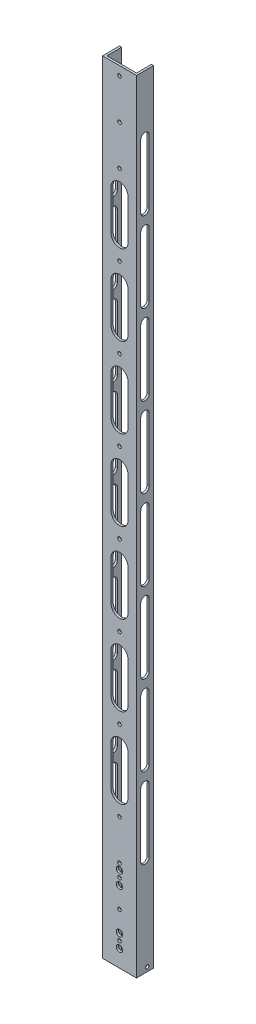
from build123d import *

# Parameters (mm, degrees)
BOSS_EXTRUDE1_DEPTH = 1168.4
IGUS_HOLES_REACH    = 1171.78
SKETCH2_R           = 2.667
CUT_EXTRUDE2_REACH  = 1171.715
SKETCH3_R           = 4.7625
SKETCH3_R_2         = 2.667
SKETCH4_R           = 2.667
CUT_EXTRUDE3_DEPTH  = 1170.77962027
BACK_CUTS_REACH     = 1171.78
CUT_EXTRUDE5_DEPTH  = 1170.77962027


with BuildPart() as part:
    # Sketch1 → Boss-Extrude1 (new body)
    with BuildSketch(Plane(origin=(0, 0, 0), x_dir=(1, 0, 0), z_dir=(0, 1, 0))):
        Polygon((3.175, 3.175), (3.175, 25.4), (0, 25.4), (0, 0), (50.8, 0), (50.8, 25.4), (47.625, 25.4), (47.625, 3.175), align=None)
    extrude(amount=BOSS_EXTRUDE1_DEPTH)

    # Sketch2 → Igus_Holes (cut, up to next)
    with BuildSketch(Plane.XY, mode=Mode.PRIVATE) as igus_holes_sk1:
        with Locations((25.4, 76.2)):
            Circle(SKETCH2_R)
    igus_holes_tool1 = extrude(igus_holes_sk1.sketch, amount=-IGUS_HOLES_REACH, mode=Mode.PRIVATE) & part.part
    # Sketch2 → Igus_Holes (cut, up to next)
    with BuildSketch(Plane.XY, mode=Mode.PRIVATE) as igus_holes_sk2:
        with Locations((25.4, 136.144)):
            Circle(SKETCH2_R)
    igus_holes_tool2 = extrude(igus_holes_sk2.sketch, amount=-IGUS_HOLES_REACH, mode=Mode.PRIVATE) & part.part
    # Sketch2 → Igus_Holes (cut, up to next)
    with BuildSketch(Plane.XY, mode=Mode.PRIVATE) as igus_holes_sk3:
        with Locations((25.4, 196.088)):
            Circle(SKETCH2_R)
    igus_holes_tool3 = extrude(igus_holes_sk3.sketch, amount=-IGUS_HOLES_REACH, mode=Mode.PRIVATE) & part.part
    # Sketch2 → Igus_Holes (cut, up to next)
    with BuildSketch(Plane.XY, mode=Mode.PRIVATE) as igus_holes_sk4:
        with Locations((25.4, 256.032)):
            Circle(SKETCH2_R)
    igus_holes_tool4 = extrude(igus_holes_sk4.sketch, amount=-IGUS_HOLES_REACH, mode=Mode.PRIVATE) & part.part
    # Sketch2 → Igus_Holes (cut, up to next)
    with BuildSketch(Plane.XY, mode=Mode.PRIVATE) as igus_holes_sk5:
        with Locations((25.4, 315.976)):
            Circle(SKETCH2_R)
    igus_holes_tool5 = extrude(igus_holes_sk5.sketch, amount=-IGUS_HOLES_REACH, mode=Mode.PRIVATE) & part.part
    # Sketch2 → Igus_Holes (cut, up to next)
    with BuildSketch(Plane.XY, mode=Mode.PRIVATE) as igus_holes_sk6:
        with Locations((25.4, 375.92)):
            Circle(SKETCH2_R)
    igus_holes_tool6 = extrude(igus_holes_sk6.sketch, amount=-IGUS_HOLES_REACH, mode=Mode.PRIVATE) & part.part
    # Sketch2 → Igus_Holes (cut, up to next)
    with BuildSketch(Plane.XY, mode=Mode.PRIVATE) as igus_holes_sk7:
        with Locations((25.4, 435.864)):
            Circle(SKETCH2_R)
    igus_holes_tool7 = extrude(igus_holes_sk7.sketch, amount=-IGUS_HOLES_REACH, mode=Mode.PRIVATE) & part.part
    # Sketch2 → Igus_Holes (cut, up to next)
    with BuildSketch(Plane.XY, mode=Mode.PRIVATE) as igus_holes_sk8:
        with Locations((25.4, 495.808)):
            Circle(SKETCH2_R)
    igus_holes_tool8 = extrude(igus_holes_sk8.sketch, amount=-IGUS_HOLES_REACH, mode=Mode.PRIVATE) & part.part
    # Sketch2 → Igus_Holes (cut, up to next)
    with BuildSketch(Plane.XY, mode=Mode.PRIVATE) as igus_holes_sk9:
        with Locations((25.4, 555.752)):
            Circle(SKETCH2_R)
    igus_holes_tool9 = extrude(igus_holes_sk9.sketch, amount=-IGUS_HOLES_REACH, mode=Mode.PRIVATE) & part.part
    # Sketch2 → Igus_Holes (cut, up to next)
    with BuildSketch(Plane.XY, mode=Mode.PRIVATE) as igus_holes_sk10:
        with Locations((25.4, 615.696)):
            Circle(SKETCH2_R)
    igus_holes_tool10 = extrude(igus_holes_sk10.sketch, amount=-IGUS_HOLES_REACH, mode=Mode.PRIVATE) & part.part
    # Sketch2 → Igus_Holes (cut, up to next)
    with BuildSketch(Plane.XY, mode=Mode.PRIVATE) as igus_holes_sk11:
        with Locations((25.4, 675.64)):
            Circle(SKETCH2_R)
    igus_holes_tool11 = extrude(igus_holes_sk11.sketch, amount=-IGUS_HOLES_REACH, mode=Mode.PRIVATE) & part.part
    # Sketch2 → Igus_Holes (cut, up to next)
    with BuildSketch(Plane.XY, mode=Mode.PRIVATE) as igus_holes_sk12:
        with Locations((25.4, 735.584)):
            Circle(SKETCH2_R)
    igus_holes_tool12 = extrude(igus_holes_sk12.sketch, amount=-IGUS_HOLES_REACH, mode=Mode.PRIVATE) & part.part
    # Sketch2 → Igus_Holes (cut, up to next)
    with BuildSketch(Plane.XY, mode=Mode.PRIVATE) as igus_holes_sk13:
        with Locations((25.4, 795.528)):
            Circle(SKETCH2_R)
    igus_holes_tool13 = extrude(igus_holes_sk13.sketch, amount=-IGUS_HOLES_REACH, mode=Mode.PRIVATE) & part.part
    # Sketch2 → Igus_Holes (cut, up to next)
    with BuildSketch(Plane.XY, mode=Mode.PRIVATE) as igus_holes_sk14:
        with Locations((25.4, 855.472)):
            Circle(SKETCH2_R)
    igus_holes_tool14 = extrude(igus_holes_sk14.sketch, amount=-IGUS_HOLES_REACH, mode=Mode.PRIVATE) & part.part
    # Sketch2 → Igus_Holes (cut, up to next)
    with BuildSketch(Plane.XY, mode=Mode.PRIVATE) as igus_holes_sk15:
        with Locations((25.4, 915.416)):
            Circle(SKETCH2_R)
    igus_holes_tool15 = extrude(igus_holes_sk15.sketch, amount=-IGUS_HOLES_REACH, mode=Mode.PRIVATE) & part.part
    # Sketch2 → Igus_Holes (cut, up to next)
    with BuildSketch(Plane.XY, mode=Mode.PRIVATE) as igus_holes_sk16:
        with Locations((25.4, 975.36)):
            Circle(SKETCH2_R)
    igus_holes_tool16 = extrude(igus_holes_sk16.sketch, amount=-IGUS_HOLES_REACH, mode=Mode.PRIVATE) & part.part
    # Sketch2 → Igus_Holes (cut, up to next)
    with BuildSketch(Plane.XY, mode=Mode.PRIVATE) as igus_holes_sk17:
        with Locations((25.4, 1035.304)):
            Circle(SKETCH2_R)
    igus_holes_tool17 = extrude(igus_holes_sk17.sketch, amount=-IGUS_HOLES_REACH, mode=Mode.PRIVATE) & part.part
    # Sketch2 → Igus_Holes (cut, up to next)
    with BuildSketch(Plane.XY, mode=Mode.PRIVATE) as igus_holes_sk18:
        with Locations((25.4, 1095.248)):
            Circle(SKETCH2_R)
    igus_holes_tool18 = extrude(igus_holes_sk18.sketch, amount=-IGUS_HOLES_REACH, mode=Mode.PRIVATE) & part.part
    # Sketch2 → Igus_Holes (cut, up to next)
    with BuildSketch(Plane.XY, mode=Mode.PRIVATE) as igus_holes_sk19:
        with Locations((25.4, 1155.192)):
            Circle(SKETCH2_R)
    igus_holes_tool19 = extrude(igus_holes_sk19.sketch, amount=-IGUS_HOLES_REACH, mode=Mode.PRIVATE) & part.part
    add(igus_holes_tool1.solids().sort_by_distance((25.4, 76.2, 0))[0], mode=Mode.SUBTRACT)
    add(igus_holes_tool2.solids().sort_by_distance((25.4, 136.144, 0))[0], mode=Mode.SUBTRACT)
    add(igus_holes_tool3.solids().sort_by_distance((25.4, 196.088, 0))[0], mode=Mode.SUBTRACT)
    add(igus_holes_tool4.solids().sort_by_distance((25.4, 256.032, 0))[0], mode=Mode.SUBTRACT)
    add(igus_holes_tool5.solids().sort_by_distance((25.4, 315.976, 0))[0], mode=Mode.SUBTRACT)
    add(igus_holes_tool6.solids().sort_by_distance((25.4, 375.92, 0))[0], mode=Mode.SUBTRACT)
    add(igus_holes_tool7.solids().sort_by_distance((25.4, 435.864, 0))[0], mode=Mode.SUBTRACT)
    add(igus_holes_tool8.solids().sort_by_distance((25.4, 495.808, 0))[0], mode=Mode.SUBTRACT)
    add(igus_holes_tool9.solids().sort_by_distance((25.4, 555.752, 0))[0], mode=Mode.SUBTRACT)
    add(igus_holes_tool10.solids().sort_by_distance((25.4, 615.696, 0))[0], mode=Mode.SUBTRACT)
    add(igus_holes_tool11.solids().sort_by_distance((25.4, 675.64, 0))[0], mode=Mode.SUBTRACT)
    add(igus_holes_tool12.solids().sort_by_distance((25.4, 735.584, 0))[0], mode=Mode.SUBTRACT)
    add(igus_holes_tool13.solids().sort_by_distance((25.4, 795.528, 0))[0], mode=Mode.SUBTRACT)
    add(igus_holes_tool14.solids().sort_by_distance((25.4, 855.472, 0))[0], mode=Mode.SUBTRACT)
    add(igus_holes_tool15.solids().sort_by_distance((25.4, 915.416, 0))[0], mode=Mode.SUBTRACT)
    add(igus_holes_tool16.solids().sort_by_distance((25.4, 975.36, 0))[0], mode=Mode.SUBTRACT)
    add(igus_holes_tool17.solids().sort_by_distance((25.4, 1035.304, 0))[0], mode=Mode.SUBTRACT)
    add(igus_holes_tool18.solids().sort_by_distance((25.4, 1095.248, 0))[0], mode=Mode.SUBTRACT)
    add(igus_holes_tool19.solids().sort_by_distance((25.4, 1155.192, 0))[0], mode=Mode.SUBTRACT)

    # Sketch3 → Cut-Extrude2 (cut, up to next)
    with BuildSketch(Plane(origin=(0, 0, -3.175), x_dir=(-1, 0, 0), z_dir=(0, 0, -1)), mode=Mode.PRIVATE) as cut_extrude2_sk1:
        with Locations((-25.4, 25.4)):
            Circle(SKETCH3_R)
    cut_extrude2_tool1 = extrude(cut_extrude2_sk1.sketch, amount=-CUT_EXTRUDE2_REACH, mode=Mode.PRIVATE) & part.part
    # Sketch3 → Cut-Extrude2 (cut, up to next)
    with BuildSketch(Plane(origin=(0, 0, -3.175), x_dir=(-1, 0, 0), z_dir=(0, 0, -1)), mode=Mode.PRIVATE) as cut_extrude2_sk2:
        with Locations((-25.400000787, 35.39998)):
            Circle(SKETCH3_R_2)
    cut_extrude2_tool2 = extrude(cut_extrude2_sk2.sketch, amount=-CUT_EXTRUDE2_REACH, mode=Mode.PRIVATE) & part.part
    # Sketch3 → Cut-Extrude2 (cut, up to next)
    with BuildSketch(Plane(origin=(0, 0, -3.175), x_dir=(-1, 0, 0), z_dir=(0, 0, -1)), mode=Mode.PRIVATE) as cut_extrude2_sk3:
        with Locations((-25.400000787, 117.00002)):
            Circle(SKETCH3_R_2)
    cut_extrude2_tool3 = extrude(cut_extrude2_sk3.sketch, amount=-CUT_EXTRUDE2_REACH, mode=Mode.PRIVATE) & part.part
    # Sketch3 → Cut-Extrude2 (cut, up to next)
    with BuildSketch(Plane(origin=(0, 0, -3.175), x_dir=(-1, 0, 0), z_dir=(0, 0, -1)), mode=Mode.PRIVATE) as cut_extrude2_sk4:
        with Locations((-25.400000787, 45.39996)):
            Circle(SKETCH3_R)
    cut_extrude2_tool4 = extrude(cut_extrude2_sk4.sketch, amount=-CUT_EXTRUDE2_REACH, mode=Mode.PRIVATE) & part.part
    # Sketch3 → Cut-Extrude2 (cut, up to next)
    with BuildSketch(Plane(origin=(0, 0, -3.175), x_dir=(-1, 0, 0), z_dir=(0, 0, -1)), mode=Mode.PRIVATE) as cut_extrude2_sk5:
        with Locations((-25.400000787, 107.00004)):
            Circle(SKETCH3_R)
    cut_extrude2_tool5 = extrude(cut_extrude2_sk5.sketch, amount=-CUT_EXTRUDE2_REACH, mode=Mode.PRIVATE) & part.part
    # Sketch3 → Cut-Extrude2 (cut, up to next)
    with BuildSketch(Plane(origin=(0, 0, -3.175), x_dir=(-1, 0, 0), z_dir=(0, 0, -1)), mode=Mode.PRIVATE) as cut_extrude2_sk6:
        with Locations((-25.400000787, 127)):
            Circle(SKETCH3_R)
    cut_extrude2_tool6 = extrude(cut_extrude2_sk6.sketch, amount=-CUT_EXTRUDE2_REACH, mode=Mode.PRIVATE) & part.part
    add(cut_extrude2_tool1.solids().sort_by_distance((25.4, 25.4, -3.175))[0], mode=Mode.SUBTRACT)
    add(cut_extrude2_tool2.solids().sort_by_distance((25.400001, 35.39998, -3.175))[0], mode=Mode.SUBTRACT)
    add(cut_extrude2_tool3.solids().sort_by_distance((25.400001, 117.00002, -3.175))[0], mode=Mode.SUBTRACT)
    add(cut_extrude2_tool4.solids().sort_by_distance((25.400001, 45.39996, -3.175))[0], mode=Mode.SUBTRACT)
    add(cut_extrude2_tool5.solids().sort_by_distance((25.400001, 107.00004, -3.175))[0], mode=Mode.SUBTRACT)
    add(cut_extrude2_tool6.solids().sort_by_distance((25.400001, 127, -3.175))[0], mode=Mode.SUBTRACT)

    # Sketch4 → Cut-Extrude3 (cut, through all)
    with BuildSketch(Plane.ZY):
        with Locations((-15.875, 6.35)):
            Circle(SKETCH4_R)
    extrude(amount=-CUT_EXTRUDE3_DEPTH, mode=Mode.SUBTRACT)

    # Sketch5 → Back_Cuts (cut, up to next)
    with BuildSketch(Plane.XY, mode=Mode.PRIVATE) as back_cuts_sk1:
        with BuildLine():
            Line((38.1, 1005.36), (38.1, 945.36))
            ThreePointArc((38.1, 945.36), (25.4, 932.66), (12.7, 945.36))
            Line((12.7, 945.36), (12.7, 1005.36))
            ThreePointArc((12.7, 1005.36), (25.4, 1018.06), (38.1, 1005.36))
        make_face()
    back_cuts_tool1 = extrude(back_cuts_sk1.sketch, amount=-BACK_CUTS_REACH, mode=Mode.PRIVATE) & part.part
    # Sketch5 → Back_Cuts (cut, up to next)
    with BuildSketch(Plane.XY, mode=Mode.PRIVATE) as back_cuts_sk2:
        with BuildLine():
            Line((38.1, 885.472), (38.1, 825.472))
            ThreePointArc((38.1, 825.472), (25.4, 812.772), (12.7, 825.472))
            Line((12.7, 825.472), (12.7, 885.472))
            ThreePointArc((12.7, 885.472), (25.4, 898.172), (38.1, 885.472))
        make_face()
    back_cuts_tool2 = extrude(back_cuts_sk2.sketch, amount=-BACK_CUTS_REACH, mode=Mode.PRIVATE) & part.part
    # Sketch5 → Back_Cuts (cut, up to next)
    with BuildSketch(Plane.XY, mode=Mode.PRIVATE) as back_cuts_sk3:
        with BuildLine():
            Line((38.1, 765.584), (38.1, 705.584))
            ThreePointArc((38.1, 705.584), (25.4, 692.884), (12.7, 705.584))
            Line((12.7, 705.584), (12.7, 765.584))
            ThreePointArc((12.7, 765.584), (25.4, 778.284), (38.1, 765.584))
        make_face()
    back_cuts_tool3 = extrude(back_cuts_sk3.sketch, amount=-BACK_CUTS_REACH, mode=Mode.PRIVATE) & part.part
    # Sketch5 → Back_Cuts (cut, up to next)
    with BuildSketch(Plane.XY, mode=Mode.PRIVATE) as back_cuts_sk4:
        with BuildLine():
            Line((38.1, 645.696), (38.1, 585.696))
            ThreePointArc((38.1, 585.696), (25.4, 572.996), (12.7, 585.696))
            Line((12.7, 585.696), (12.7, 645.696))
            ThreePointArc((12.7, 645.696), (25.4, 658.396), (38.1, 645.696))
        make_face()
    back_cuts_tool4 = extrude(back_cuts_sk4.sketch, amount=-BACK_CUTS_REACH, mode=Mode.PRIVATE) & part.part
    # Sketch5 → Back_Cuts (cut, up to next)
    with BuildSketch(Plane.XY, mode=Mode.PRIVATE) as back_cuts_sk5:
        with BuildLine():
            Line((38.1, 525.808), (38.1, 465.808))
            ThreePointArc((38.1, 465.808), (25.4, 453.108), (12.7, 465.808))
            Line((12.7, 465.808), (12.7, 525.808))
            ThreePointArc((12.7, 525.808), (25.4, 538.508), (38.1, 525.808))
        make_face()
    back_cuts_tool5 = extrude(back_cuts_sk5.sketch, amount=-BACK_CUTS_REACH, mode=Mode.PRIVATE) & part.part
    # Sketch5 → Back_Cuts (cut, up to next)
    with BuildSketch(Plane.XY, mode=Mode.PRIVATE) as back_cuts_sk6:
        with BuildLine():
            Line((38.1, 405.92), (38.1, 345.92))
            ThreePointArc((38.1, 345.92), (25.4, 333.22), (12.7, 345.92))
            Line((12.7, 345.92), (12.7, 405.92))
            ThreePointArc((12.7, 405.92), (25.4, 418.62), (38.1, 405.92))
        make_face()
    back_cuts_tool6 = extrude(back_cuts_sk6.sketch, amount=-BACK_CUTS_REACH, mode=Mode.PRIVATE) & part.part
    # Sketch5 → Back_Cuts (cut, up to next)
    with BuildSketch(Plane.XY, mode=Mode.PRIVATE) as back_cuts_sk7:
        with BuildLine():
            Line((38.1, 286.032), (38.1, 226.032))
            ThreePointArc((38.1, 226.032), (25.4, 213.332), (12.7, 226.032))
            Line((12.7, 226.032), (12.7, 286.032))
            ThreePointArc((12.7, 286.032), (25.4, 298.732), (38.1, 286.032))
        make_face()
    back_cuts_tool7 = extrude(back_cuts_sk7.sketch, amount=-BACK_CUTS_REACH, mode=Mode.PRIVATE) & part.part
    add(back_cuts_tool1.solids().sort_by_distance((25.4, 975.36, 0))[0], mode=Mode.SUBTRACT)
    add(back_cuts_tool2.solids().sort_by_distance((25.4, 855.472, 0))[0], mode=Mode.SUBTRACT)
    add(back_cuts_tool3.solids().sort_by_distance((25.4, 735.584, 0))[0], mode=Mode.SUBTRACT)
    add(back_cuts_tool4.solids().sort_by_distance((25.4, 615.696, 0))[0], mode=Mode.SUBTRACT)
    add(back_cuts_tool5.solids().sort_by_distance((25.4, 495.808, 0))[0], mode=Mode.SUBTRACT)
    add(back_cuts_tool6.solids().sort_by_distance((25.4, 375.92, 0))[0], mode=Mode.SUBTRACT)
    add(back_cuts_tool7.solids().sort_by_distance((25.4, 256.032, 0))[0], mode=Mode.SUBTRACT)

    # Sketch6 → Cut-Extrude5 (cut, through all)
    with BuildSketch(Plane.ZY):
        with BuildLine():
            Line((-6.35, 1082.05), (-6.35, 987.25))
            ThreePointArc((-6.35, 987.25), (-12.7, 980.9), (-19.05, 987.25))
            Line((-19.05, 987.25), (-19.05, 1082.05))
            ThreePointArc((-19.05, 1082.05), (-12.7, 1088.4), (-6.35, 1082.05))
        make_face()
        with BuildLine():
            Line((-6.35, 962.05), (-6.35, 867.25))
            ThreePointArc((-6.35, 867.25), (-12.7, 860.9), (-19.05, 867.25))
            Line((-19.05, 867.25), (-19.05, 962.05))
            ThreePointArc((-19.05, 962.05), (-12.7, 968.4), (-6.35, 962.05))
        make_face()
        with BuildLine():
            Line((-6.35, 842.05), (-6.35, 747.25))
            ThreePointArc((-6.35, 747.25), (-12.7, 740.9), (-19.05, 747.25))
            Line((-19.05, 747.25), (-19.05, 842.05))
            ThreePointArc((-19.05, 842.05), (-12.7, 848.4), (-6.35, 842.05))
        make_face()
        with BuildLine():
            Line((-6.35, 722.05), (-6.35, 627.25))
            ThreePointArc((-6.35, 627.25), (-12.7, 620.9), (-19.05, 627.25))
            Line((-19.05, 627.25), (-19.05, 722.05))
            ThreePointArc((-19.05, 722.05), (-12.7, 728.4), (-6.35, 722.05))
        make_face()
        with BuildLine():
            Line((-6.35, 602.05), (-6.35, 507.25))
            ThreePointArc((-6.35, 507.25), (-12.7, 500.9), (-19.05, 507.25))
            Line((-19.05, 507.25), (-19.05, 602.05))
            ThreePointArc((-19.05, 602.05), (-12.7, 608.4), (-6.35, 602.05))
        make_face()
        with BuildLine():
            Line((-6.35, 482.05), (-6.35, 387.25))
            ThreePointArc((-6.35, 387.25), (-12.7, 380.9), (-19.05, 387.25))
            Line((-19.05, 387.25), (-19.05, 482.05))
            ThreePointArc((-19.05, 482.05), (-12.7, 488.4), (-6.35, 482.05))
        make_face()
        with BuildLine():
            Line((-6.35, 362.05), (-6.35, 267.25))
            ThreePointArc((-6.35, 267.25), (-12.7, 260.9), (-19.05, 267.25))
            Line((-19.05, 267.25), (-19.05, 362.05))
            ThreePointArc((-19.05, 362.05), (-12.7, 368.4), (-6.35, 362.05))
        make_face()
        with BuildLine():
            Line((-6.35, 242.05), (-6.35, 147.25))
            ThreePointArc((-6.35, 147.25), (-12.7, 140.9), (-19.05, 147.25))
            Line((-19.05, 147.25), (-19.05, 242.05))
            ThreePointArc((-19.05, 242.05), (-12.7, 248.4), (-6.35, 242.05))
        make_face()
    extrude(amount=-CUT_EXTRUDE5_DEPTH, mode=Mode.SUBTRACT)


solid = part.part
